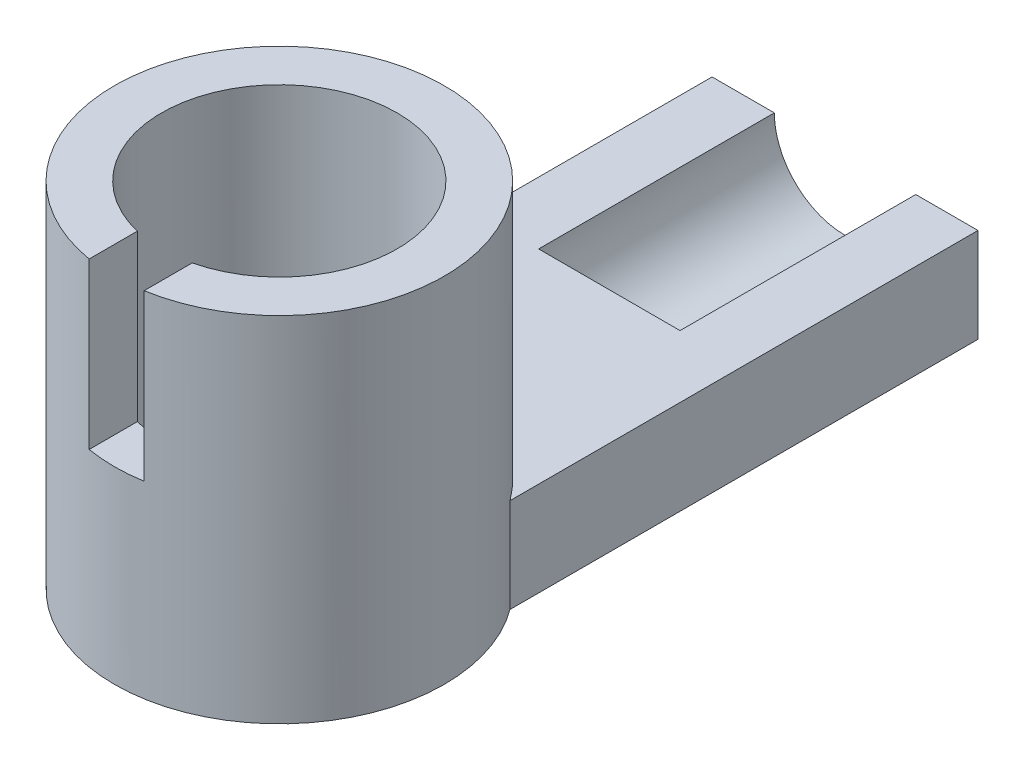
from build123d import *

# Parameters (mm, degrees)
SKETCH3_R               = 70000
SKETCH3_R_2             = 50000
BOSS_EXTRUDE1_DEPTH     = 150000
SKETCH7_W               = 112822.571730932
SKETCH7_H               = 198557.786962263
BOSS_EXTRUDE3_DEPTH     = 40000
SKETCH8_R               = 30000
CUT_EXTRUDE1_DEPTH      = 100000
CUT_EXTRUDE2_DEPTH      = 26529
CUT_EXTRUDE2_DEPTH_BACK = 86482
SKETCH9_R               = 50000
CUT_EXTRUDE4_DEPTH      = 43724
CUT_EXTRUDE4_DEPTH_BACK = 70000
SKETCH11_W              = 23317.46593379
SKETCH11_H              = 104003.866310114


with BuildPart() as part:
    # Sketch3 → Boss-Extrude1 (new body)
    with BuildSketch(Plane(origin=(0, 0, 0), x_dir=(1, 0, 0), z_dir=(0, 1, 0))):
        Circle(SKETCH3_R)
        Circle(SKETCH3_R_2, mode=Mode.SUBTRACT)
    extrude(amount=BOSS_EXTRUDE1_DEPTH)

    # Sketch7 → Boss-Extrude3 (add)
    with BuildSketch(Plane.XZ):
        with Locations((0, -140724.844151912)):
            Rectangle(SKETCH7_W, SKETCH7_H)
    extrude(amount=-BOSS_EXTRUDE3_DEPTH)

    # Sketch8 → Cut-Extrude1 (cut)
    with BuildSketch(Plane(origin=(0, 0, -240003.737633043), x_dir=(-1, 0, 0), z_dir=(0, 0, -1))):
        with Locations((0, 40000)):
            Circle(SKETCH8_R)
    extrude(amount=-CUT_EXTRUDE1_DEPTH, mode=Mode.SUBTRACT)

    # Sketch9 → Cut-Extrude2 (cut, two sides: drawn at the far end of the back side and taken through both)
    with BuildSketch(Plane(origin=(0, 40000, 0), x_dir=(1, 0, 0), z_dir=(0, 1, 0)).offset(-CUT_EXTRUDE2_DEPTH_BACK)):
        Circle(SKETCH9_R)
    extrude(amount=CUT_EXTRUDE2_DEPTH + CUT_EXTRUDE2_DEPTH_BACK, mode=Mode.SUBTRACT)

    # Sketch11 → Cut-Extrude4 (cut, two sides: drawn at the far end of the back side and taken through both)
    with BuildSketch(Plane(origin=(0, 150000, 0), x_dir=(1, 0, 0), z_dir=(0, 1, 0)).offset(-CUT_EXTRUDE4_DEPTH_BACK)):
        with Locations((0, -32001.933155057)):
            Rectangle(SKETCH11_W, SKETCH11_H)
    extrude(amount=CUT_EXTRUDE4_DEPTH + CUT_EXTRUDE4_DEPTH_BACK, mode=Mode.SUBTRACT)


solid = part.part
